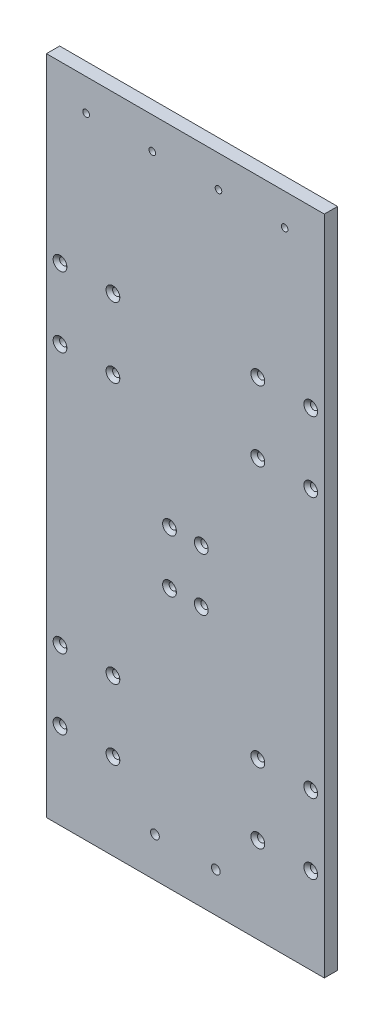
from build123d import *

# Parameters (mm, degrees)
SKETCH1_W                                       = 210
SKETCH1_H                                       = 500
BASE_FLANGE1_DEPTH                              = 10
SKETCH2_R                                       = 2.75
CUT_EXTRUDE1_DEPTH                              = 10
SKETCH3_R                                       = 3.3
CUT_EXTRUDE2_DEPTH                              = 10
SKETCH4_R                                       = 2.75
CUT_EXTRUDE3_DEPTH                              = 10
M6X1_0_TAPPED_HOLE1_D                           = 5
M6X1_0_TAPPED_HOLE1_DEPTH                       = 15
M6X1_0_TAPPED_HOLE1_CSINK_D                     = 6.05
M6X1_0_TAPPED_HOLE1_CSINK_ANGLE                 = 90
M6X1_0_TAPPED_HOLE1_TIP                         = 1.502151548
CSK_FOR_M5_FLAT_HEAD_MACHINE_SCREW1_D           = 5.5
CSK_FOR_M5_FLAT_HEAD_MACHINE_SCREW1_DEPTH       = 24.5
CSK_FOR_M5_FLAT_HEAD_MACHINE_SCREW1_CSINK_D     = 10.4
CSK_FOR_M5_FLAT_HEAD_MACHINE_SCREW1_CSINK_ANGLE = 90
CSK_FOR_M5_FLAT_HEAD_MACHINE_SCREW1_TIP         = 1.652366702
CSK_FOR_M5_FLAT_HEAD_MACHINE_SCREW2_D           = 5.5
CSK_FOR_M5_FLAT_HEAD_MACHINE_SCREW2_DEPTH       = 24.5
CSK_FOR_M5_FLAT_HEAD_MACHINE_SCREW2_CSINK_D     = 10.4
CSK_FOR_M5_FLAT_HEAD_MACHINE_SCREW2_CSINK_ANGLE = 90
CSK_FOR_M5_FLAT_HEAD_MACHINE_SCREW2_TIP         = 1.652366702


# Sheet-metal steps are written as plain solids
with BuildPart() as part:
    # Sketch1 → Base-Flange1 (new body)
    with BuildSketch(Plane.XY):
        Rectangle(SKETCH1_W, SKETCH1_H)
    extrude(amount=-BASE_FLANGE1_DEPTH)

    # Sketch2 → Cut-Extrude1 (cut)
    with BuildSketch(Plane.XY):
        with Locations((-94.75, 118)):
            Circle(SKETCH2_R)
        with Locations((-94.75, 65)):
            Circle(SKETCH2_R)
        with Locations((-54.75, 118)):
            Circle(SKETCH2_R)
        with Locations((-54.75, 65)):
            Circle(SKETCH2_R)
        with Locations((54.75, 118)):
            Circle(SKETCH2_R)
        with Locations((54.75, 65)):
            Circle(SKETCH2_R)
        with Locations((94.75, 118)):
            Circle(SKETCH2_R)
        with Locations((94.75, 65)):
            Circle(SKETCH2_R)
        with Locations((-54.75, -132)):
            Circle(SKETCH2_R)
        with Locations((-94.75, -132)):
            Circle(SKETCH2_R)
        with Locations((-94.75, -185)):
            Circle(SKETCH2_R)
        with Locations((-54.75, -185)):
            Circle(SKETCH2_R)
        with Locations((54.75, -132)):
            Circle(SKETCH2_R)
        with Locations((94.75, -132)):
            Circle(SKETCH2_R)
        with Locations((94.75, -185)):
            Circle(SKETCH2_R)
        with Locations((54.75, -185)):
            Circle(SKETCH2_R)
    extrude(amount=-CUT_EXTRUDE1_DEPTH, mode=Mode.SUBTRACT)

    # Sketch3 → Cut-Extrude2 (cut)
    with BuildSketch(Plane.XY):
        with Locations((-23, -220)):
            Circle(SKETCH3_R)
        with Locations((23, -220)):
            Circle(SKETCH3_R)
    extrude(amount=-CUT_EXTRUDE2_DEPTH, mode=Mode.SUBTRACT)

    # Sketch4 → Cut-Extrude3 (cut)
    with BuildSketch(Plane.XY):
        with Locations((12, -13.5)):
            Circle(SKETCH4_R)
        with Locations((12, -53.5)):
            Circle(SKETCH4_R)
        with Locations((-12, -53.5)):
            Circle(SKETCH4_R)
        with Locations((-12, -13.5)):
            Circle(SKETCH4_R)
    extrude(amount=-CUT_EXTRUDE3_DEPTH, mode=Mode.SUBTRACT)

    # M6x1.0 Tapped Hole1
    with Locations(Plane(origin=(0, 0, -10), x_dir=(-1, 0, 0), z_dir=(0, 0, -1))):
        with Locations((-75, 226), (-25, 226), (25, 226), (75, 226)):
            CounterSinkHole(M6X1_0_TAPPED_HOLE1_D / 2, M6X1_0_TAPPED_HOLE1_CSINK_D / 2, depth=M6X1_0_TAPPED_HOLE1_DEPTH, counter_sink_angle=M6X1_0_TAPPED_HOLE1_CSINK_ANGLE)
            with Locations((0, 0, -(M6X1_0_TAPPED_HOLE1_DEPTH + M6X1_0_TAPPED_HOLE1_TIP / 2))):  # 118° drill point
                Cone(0, M6X1_0_TAPPED_HOLE1_D / 2, M6X1_0_TAPPED_HOLE1_TIP, mode=Mode.SUBTRACT)

    # CSK for M5 Flat Head Machine Screw1
    with Locations(Plane(origin=(0, 0, 0), x_dir=(-1, 0, 0), z_dir=(0, 0, 1))):
        with Locations((-54.75, -118), (-94.75, -118), (-94.75, -65), (-54.75, -65), (54.75, -118), (94.75, -118), (54.75, -65), (94.75, -65), (-94.75, 132), (-54.75, 132), (-94.75, 185), (-54.75, 185), (54.75, 132), (54.75, 185), (94.75, 132), (94.75, 185)):
            CounterSinkHole(CSK_FOR_M5_FLAT_HEAD_MACHINE_SCREW1_D / 2, CSK_FOR_M5_FLAT_HEAD_MACHINE_SCREW1_CSINK_D / 2, depth=CSK_FOR_M5_FLAT_HEAD_MACHINE_SCREW1_DEPTH, counter_sink_angle=CSK_FOR_M5_FLAT_HEAD_MACHINE_SCREW1_CSINK_ANGLE)
            with Locations((0, 0, -(CSK_FOR_M5_FLAT_HEAD_MACHINE_SCREW1_DEPTH + CSK_FOR_M5_FLAT_HEAD_MACHINE_SCREW1_TIP / 2))):  # 118° drill point
                Cone(0, CSK_FOR_M5_FLAT_HEAD_MACHINE_SCREW1_D / 2, CSK_FOR_M5_FLAT_HEAD_MACHINE_SCREW1_TIP, mode=Mode.SUBTRACT)

    # CSK for M5 Flat Head Machine Screw2
    with Locations(Plane.XY):
        with Locations((12, -13.5), (-12, -13.5), (-12, -53.5), (12, -53.5)):
            CounterSinkHole(CSK_FOR_M5_FLAT_HEAD_MACHINE_SCREW2_D / 2, CSK_FOR_M5_FLAT_HEAD_MACHINE_SCREW2_CSINK_D / 2, depth=CSK_FOR_M5_FLAT_HEAD_MACHINE_SCREW2_DEPTH, counter_sink_angle=CSK_FOR_M5_FLAT_HEAD_MACHINE_SCREW2_CSINK_ANGLE)
            with Locations((0, 0, -(CSK_FOR_M5_FLAT_HEAD_MACHINE_SCREW2_DEPTH + CSK_FOR_M5_FLAT_HEAD_MACHINE_SCREW2_TIP / 2))):  # 118° drill point
                Cone(0, CSK_FOR_M5_FLAT_HEAD_MACHINE_SCREW2_D / 2, CSK_FOR_M5_FLAT_HEAD_MACHINE_SCREW2_TIP, mode=Mode.SUBTRACT)


solid = part.part
